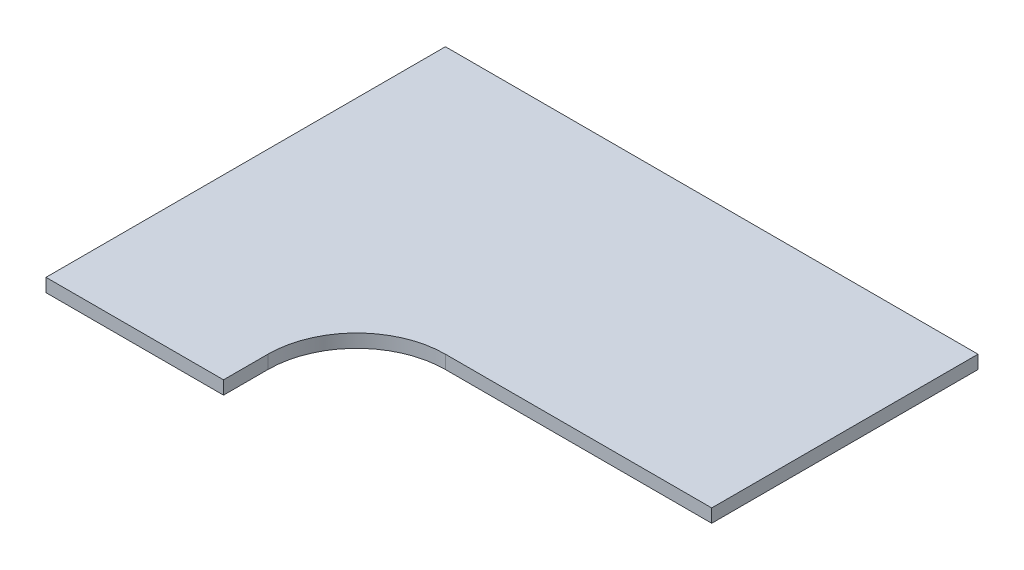
from build123d import *

# Parameters (mm, degrees)
BOSS_EXTRUDE1_DEPTH = 30


with BuildPart() as part:
    # Sketch1 → Boss-Extrude1 (new body)
    with BuildSketch(Plane(origin=(0, 0, 0), x_dir=(1, 0, 0), z_dir=(0, 1, 0))):
        with BuildLine():
            Line((0, 0), (0, -900))
            Line((0, -900), (400, -900))
            Line((400, -900), (400, -800))
            ThreePointArc((400, -800), (458.578643763, -658.578643763), (600, -600))
            Line((600, -600), (1200, -600))
            Line((1200, -600), (1200, 0))
            Line((1200, 0), (0, 0))
        make_face()
    extrude(amount=BOSS_EXTRUDE1_DEPTH)


solid = part.part
